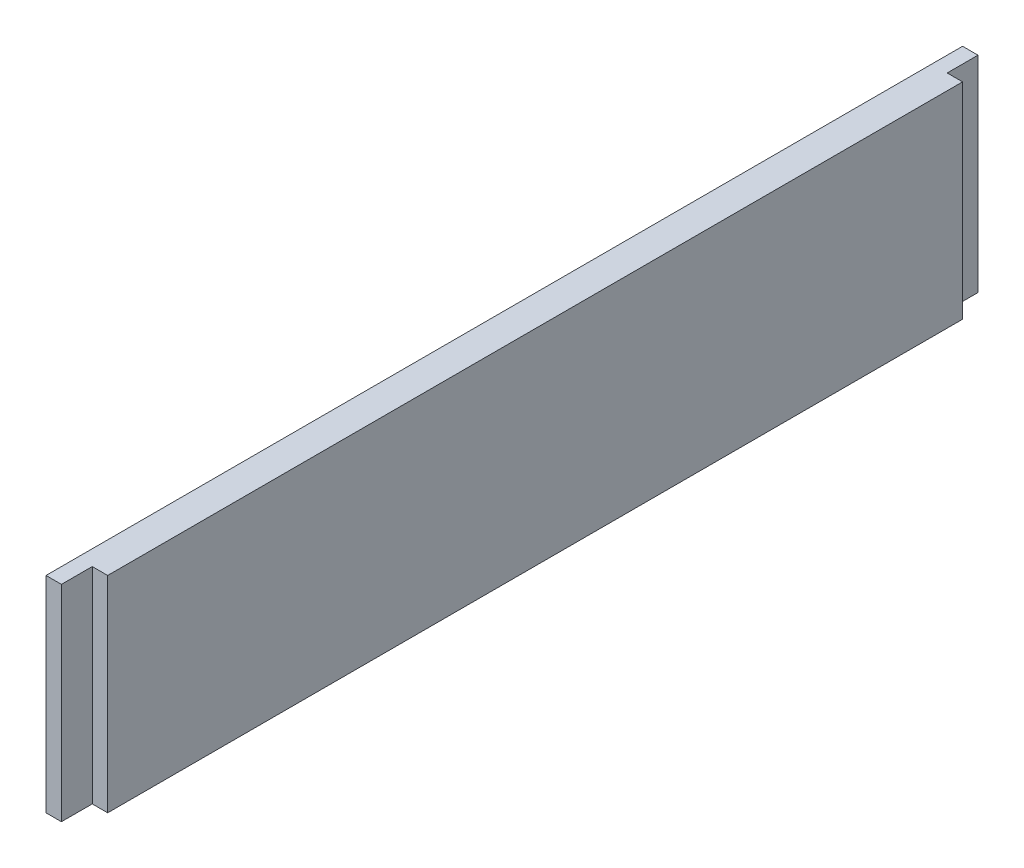
from build123d import *

# Parameters (mm, degrees)
SKETCH1_W           = 535
SKETCH1_H           = 120
BOSS_EXTRUDE1_DEPTH = 18
SKETCH2_W           = 18
SKETCH2_H           = 120
CUT_EXTRUDE1_DEPTH  = 9


with BuildPart() as part:
    # Sketch1 → Boss-Extrude1 (new body)
    with BuildSketch(Plane(origin=(0, 0, 0), x_dir=(0, 0, -1), z_dir=(1, 0, 0))):
        with Locations((267.5, 60)):
            Rectangle(SKETCH1_W, SKETCH1_H)
    extrude(amount=BOSS_EXTRUDE1_DEPTH)

    # Sketch2 → Cut-Extrude1 (cut)
    with BuildSketch(Plane(origin=(18, 0, 0), x_dir=(0, 0, -1), z_dir=(1, 0, 0))):
        with Locations((9, 60)):
            Rectangle(SKETCH2_W, SKETCH2_H)
        with Locations((526, 60)):
            Rectangle(SKETCH2_W, SKETCH2_H)
    extrude(amount=-CUT_EXTRUDE1_DEPTH, mode=Mode.SUBTRACT)


solid = part.part
